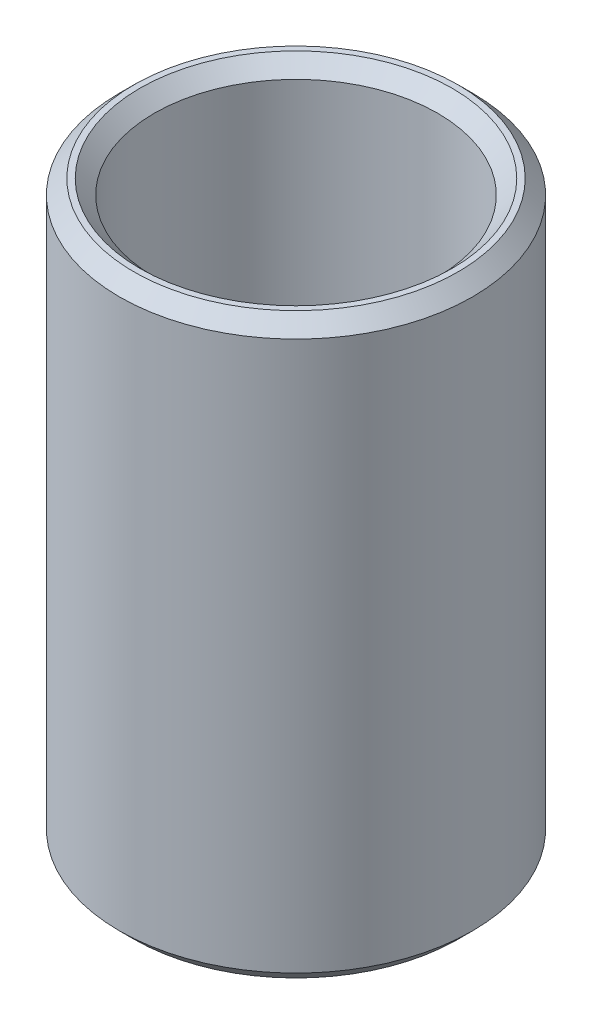
from build123d import *

# Parameters (mm, degrees)
SKETCH1_R           = 45
BOSS_EXTRUDE1_DEPTH = 147.334308334
SKETCH2_R           = 36.118467659
CUT_EXTRUDE1_DEPTH  = 161.491116303
CHAMFER1_SIZE       = 3.680206045


with BuildPart() as part:
    # Sketch1 → Boss-Extrude1 (new body)
    with BuildSketch(Plane(origin=(0, 0, 0), x_dir=(1, 0, 0), z_dir=(0, 1, 0))):
        Circle(SKETCH1_R)
    extrude(amount=BOSS_EXTRUDE1_DEPTH)

    # Sketch2 → Cut-Extrude1 (cut, through all)
    with BuildSketch(Plane(origin=(0, 0, 0), x_dir=(1, 0, 0), z_dir=(0, 1, 0))):
        Circle(SKETCH2_R)
    extrude(amount=CUT_EXTRUDE1_DEPTH, mode=Mode.SUBTRACT)

    # Chamfer1
    chamfer1_edges = [part.edges().sort_by_distance(p)[0] for p in [
        (-36.118467659, 147.334308334, 0),
        (-36.118467659, 0, 0),
        (-45, 0, 0),
        (-45, 147.334308334, 0),
    ]]
    chamfer(chamfer1_edges, length=CHAMFER1_SIZE)


solid = part.part
